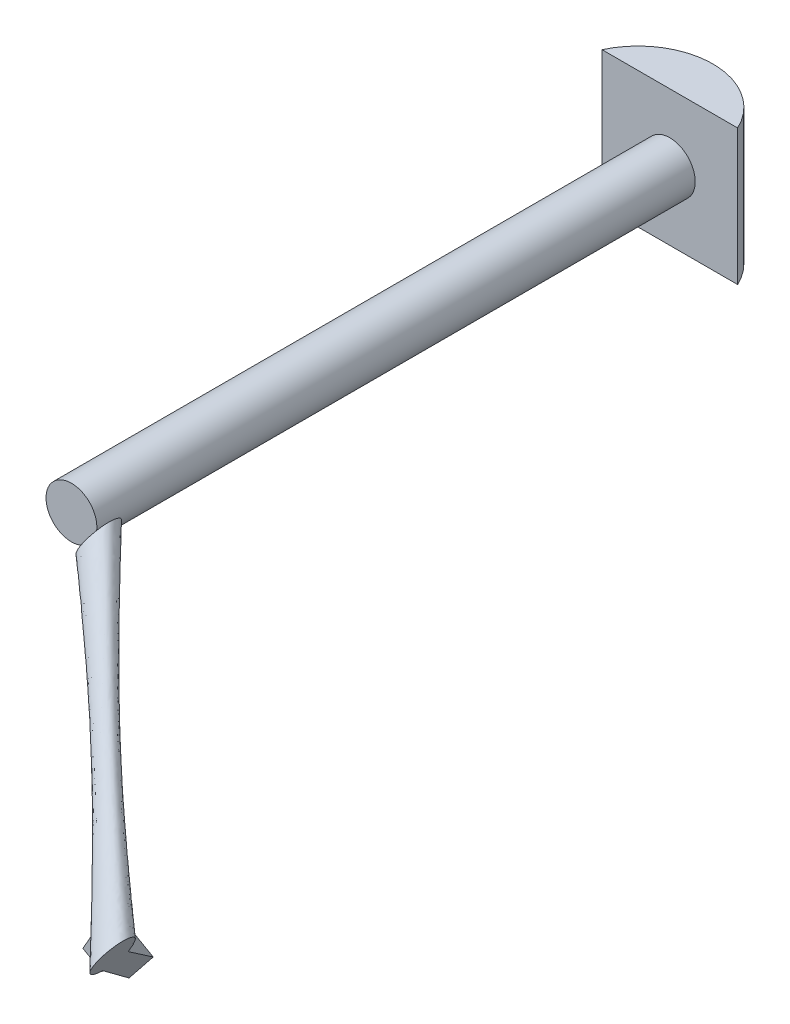
from build123d import *

# Parameters (mm, degrees)
SKETCH1_R           = 2.38125
BOSS_EXTRUDE1_DEPTH = 58.596630013
BOSS_EXTRUDE2_DEPTH = 6.35
BOSS_EXTRUDE4_DEPTH = 2.032


with BuildPart() as part:
    # Sketch1 → Boss-Extrude1 (new body)
    with BuildSketch(Plane.XY):
        Circle(SKETCH1_R)
    extrude(amount=BOSS_EXTRUDE1_DEPTH)

    # Sketch2 → Boss-Extrude2 (add, symmetric)
    with BuildSketch(Plane(origin=(0, 0, 0), x_dir=(1, 0, 0), z_dir=(0, 1, 0))):
        with BuildLine():
            Line((-6.35, -2.563701192), (0, -2.563701192))
            Line((0, -2.563701192), (6.35, -2.563701192))
            ThreePointArc((6.35, -2.563701192), (0, 1.474189404), (-6.35, -2.563701192))
        make_face()
    extrude(amount=BOSS_EXTRUDE2_DEPTH, both=True)


with BuildPart() as body_2:
    # Loft1: read off the stored shape, not the designer's step
    # Loft1: loft between two sections, ruled curve by curve
    loft1_from = [
        Edge.make_bspline([(24.635403527, -12.878615764, 80.537548375), (24.703010916, -12.759717555, 80.455728817), (24.77457053, -12.633868737, 80.346542629), (24.911732936, -12.392647108, 80.047422189), (24.977401408, -12.277158789, 79.856219839), (25.072825843, -12.109339936, 79.38415277), (25.101598912, -12.058737976, 79.101944057), (25.087030549, -12.08435873, 78.502649545), (25.042262607, -12.163090185, 78.187958466), (24.880490774, -12.447591356, 77.640856383), (24.76460641, -12.651392206, 77.412231552), (24.510487992, -13.098299348, 77.102844403), (24.373971523, -13.338384995, 77.020671771), (24.123246128, -13.779324972, 76.96752084), (24.008916688, -13.980391244, 76.994154883), (23.813775258, -14.323578092, 77.097193937), (23.732379916, -14.466724581, 77.173116318), (23.597165139, -14.704520999, 77.336755435), (23.525605524, -14.830369818, 77.445941623), (23.388443119, -15.071591446, 77.745062063), (23.322774646, -15.187079766, 77.936264413), (23.227350212, -15.354898618, 78.408331482), (23.198577142, -15.405500579, 78.690540195), (23.213145506, -15.379879824, 79.289834707), (23.257913447, -15.30114837, 79.604525786), (23.41968528, -15.016647199, 80.151627869), (23.535569644, -14.812846348, 80.3802527), (23.789688063, -14.365939206, 80.689639849), (23.926204532, -14.125853559, 80.771812481), (24.176929926, -13.684913583, 80.824963412), (24.291259366, -13.483847311, 80.798329369), (24.486400797, -13.140660463, 80.695290315), (24.567796138, -12.997513973, 80.619367934), (24.635403527, -12.878615764, 80.537548375)], [0, 0, 0, 0, 0.0625, 0.0625, 0.125, 0.125, 0.1875, 0.1875, 0.25, 0.25, 0.3125, 0.3125, 0.375, 0.375, 0.4375, 0.4375, 0.5, 0.5, 0.5625, 0.5625, 0.625, 0.625, 0.6875, 0.6875, 0.75, 0.75, 0.8125, 0.8125, 0.875, 0.875, 0.9375, 0.9375, 1, 1, 1, 1], 3),
    ]
    loft1_to = [
        Edge.make_bspline([(2.767629763, 0.049839418, 56.82236264), (2.714463118, -0.043662476, 56.704750196), (2.64725177, -0.161864184, 56.584786377), (2.474918122, -0.464939965, 56.372841519), (2.369168557, -0.65091718, 56.28098433), (2.12144239, -1.086582543, 56.186412949), (1.979011826, -1.337069056, 56.185916163), (1.691706982, -1.842339737, 56.334845804), (1.548278172, -2.094581822, 56.486619954), (1.315737433, -2.503541227, 56.916862609), (1.228234782, -2.657428378, 57.192353655), (1.129312793, -2.83139823, 57.758013891), (1.116866397, -2.853287171, 58.045061216), (1.141353454, -2.810222836, 58.552665546), (1.177154765, -2.747260609, 58.773939726), (1.266145812, -2.590755879, 59.140083551), (1.319218682, -2.497418903, 59.286206124), (1.425551973, -2.310415115, 59.521431011), (1.49276332, -2.192213406, 59.64139483), (1.665096968, -1.889137626, 59.853339688), (1.770846533, -1.70316041, 59.945196877), (2.0185727, -1.267495047, 60.039768258), (2.161003265, -1.017008534, 60.040265044), (2.448308108, -0.511737853, 59.891335404), (2.591736918, -0.259495768, 59.739561253), (2.824277658, 0.149463636, 59.309318598), (2.911780308, 0.303350787, 59.033827552), (3.010702298, 0.477320639, 58.468167316), (3.023148693, 0.49920958, 58.181119991), (2.998661636, 0.456145246, 57.673515661), (2.962860325, 0.393183019, 57.452241481), (2.873869279, 0.236678289, 57.086097656), (2.820796408, 0.143341312, 56.939975083), (2.767629763, 0.049839418, 56.82236264)], [0, 0, 0, 0, 0.0625, 0.0625, 0.125, 0.125, 0.1875, 0.1875, 0.25, 0.25, 0.3125, 0.3125, 0.375, 0.375, 0.4375, 0.4375, 0.5, 0.5, 0.5625, 0.5625, 0.625, 0.625, 0.6875, 0.6875, 0.75, 0.75, 0.8125, 0.8125, 0.875, 0.875, 0.9375, 0.9375, 1, 1, 1, 1], 3),
    ]
    loft1 = Solid(Shell([*[Face.make_surface_from_curves(loft1_from[k], loft1_to[k]) for k in range(1)], Face(Wire(loft1_from)), Face(Wire(loft1_to))]))
    add(loft1)

    # Sketch8 → Boss-Extrude4 (add)
    with BuildSketch(Plane(origin=(24.150088027, -13.732119277, 0), x_dir=(0, 0, -1), z_dir=(0.869294507164732, -0.49429450716473244, 0))):
        Polygon((-78.75825642, -2.050545662), (-73.982171856, -6.826630226), (-72.464389408, -5.308847777), (-76.921993148, -1.025272831), (-76.921993148, 0), (-78.896242126, 0), (-78.896242126, -2.050545662), align=None)
    extrude(amount=-BOSS_EXTRUDE4_DEPTH)


solid = Compound([part.part, body_2.part])
